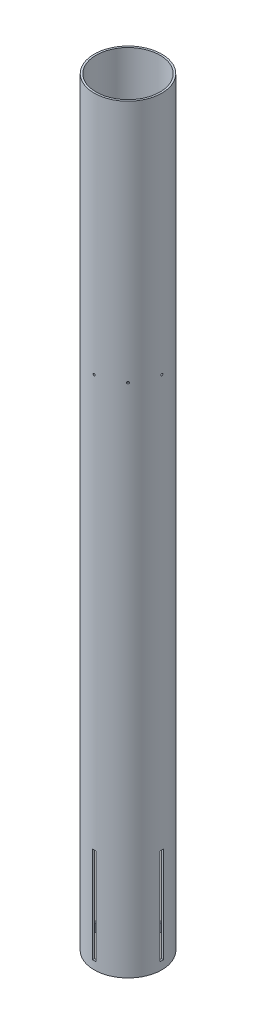
from build123d import *

# Parameters (mm, degrees)
SKETCH1_R                 = 53.721
SKETCH1_R_2               = 50.8
BODY_TUBE_EXTRUSION_DEPTH = 1206.5
ENGINE_BLOCK_HOLE_REACH   = 1214.465
SKETCH2_R                 = 1.6383
CIRPATTERN1_COUNT         = 8
CUT_EXTRUDE1_REACH        = 1214.465
SKETCH3_W                 = 5.334
SKETCH3_H                 = 152.4
CIRPATTERN2_COUNT         = 4


with BuildPart() as part:
    # Sketch1 → Body Tube Extrusion (new body)
    with BuildSketch(Plane(origin=(0, 0, 0), x_dir=(1, 0, 0), z_dir=(0, 1, 0))):
        Circle(SKETCH1_R)
        Circle(SKETCH1_R_2, mode=Mode.SUBTRACT)
    extrude(amount=BODY_TUBE_EXTRUSION_DEPTH)

    # Sketch2 → Engine Block Hole (cut, up to next)
    with BuildSketch(Plane.XY.offset(53.721), mode=Mode.PRIVATE) as engine_block_hole_sk1:
        with Locations((0, 819.15)):
            Circle(SKETCH2_R)
    engine_block_hole_tool1 = extrude(engine_block_hole_sk1.sketch, amount=-ENGINE_BLOCK_HOLE_REACH, mode=Mode.PRIVATE) & part.part
    engine_block_hole = engine_block_hole_tool1.solids().sort_by_distance((0, 819.15, 53.721))[0]
    add(engine_block_hole, mode=Mode.SUBTRACT)

    # CirPattern1: Engine Block Hole ×8 about axis
    cirpattern1_axis = Axis((0, 1206.5, 0), (0, -1, 0))
    for i in range(1, CIRPATTERN1_COUNT):
        add(engine_block_hole.rotate(cirpattern1_axis, i * 360 / CIRPATTERN1_COUNT), mode=Mode.SUBTRACT)

    # Sketch3 → Cut-Extrude1 (cut, up to next)
    with BuildSketch(Plane.XY.offset(53.721), mode=Mode.PRIVATE) as cut_extrude1_sk1:
        with Locations((0, 88.9)):
            Rectangle(SKETCH3_W, SKETCH3_H)
    cut_extrude1_tool1 = extrude(cut_extrude1_sk1.sketch, amount=-CUT_EXTRUDE1_REACH, mode=Mode.PRIVATE) & part.part
    cut_extrude1 = cut_extrude1_tool1.solids().sort_by_distance((0, 88.9, 53.721))[0]
    add(cut_extrude1, mode=Mode.SUBTRACT)

    # CirPattern2: Cut-Extrude1 ×4 about axis
    cirpattern2_axis = Axis((0, 1206.5, 0), (0, -1, 0))
    for i in range(1, CIRPATTERN2_COUNT):
        add(cut_extrude1.rotate(cirpattern2_axis, i * 360 / CIRPATTERN2_COUNT), mode=Mode.SUBTRACT)


solid = part.part
